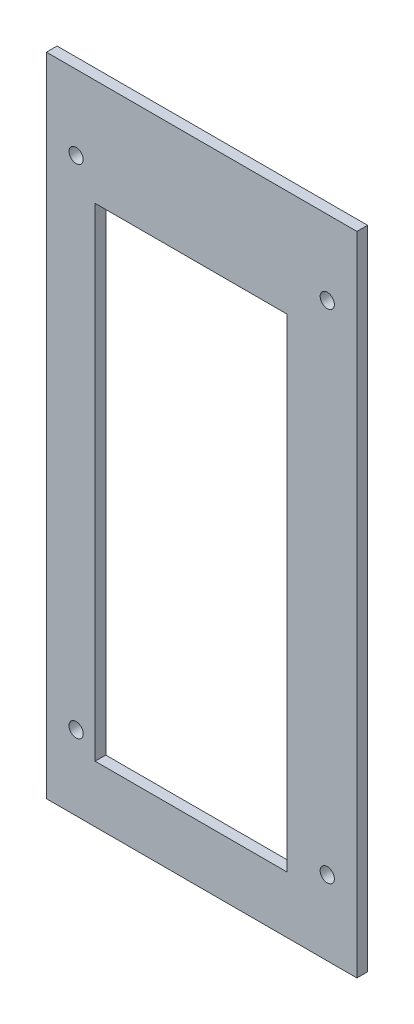
from build123d import *

# Parameters (mm, degrees)
SKETCH1_W           = 43.7
SKETCH1_H           = 91
SKETCH1_R           = 1
SKETCH1_W_2         = 27
SKETCH1_H_2         = 68
BOSS_EXTRUDE1_DEPTH = 1.5


with BuildPart() as part:
    # Sketch1 → Boss-Extrude1 (new body)
    with BuildSketch(Plane.XY):
        Rectangle(SKETCH1_W, SKETCH1_H)
        with Locations((17.675, 35)):
            Circle(SKETCH1_R, mode=Mode.SUBTRACT)
        with Locations((17.675, -35)):
            Circle(SKETCH1_R, mode=Mode.SUBTRACT)
        with Locations((-17.675, 35)):
            Circle(SKETCH1_R, mode=Mode.SUBTRACT)
        with Locations((-17.675, -35)):
            Circle(SKETCH1_R, mode=Mode.SUBTRACT)
        with Locations((-1.5, -3.5)):
            Rectangle(SKETCH1_W_2, SKETCH1_H_2, mode=Mode.SUBTRACT)
    extrude(amount=BOSS_EXTRUDE1_DEPTH)


solid = part.part
